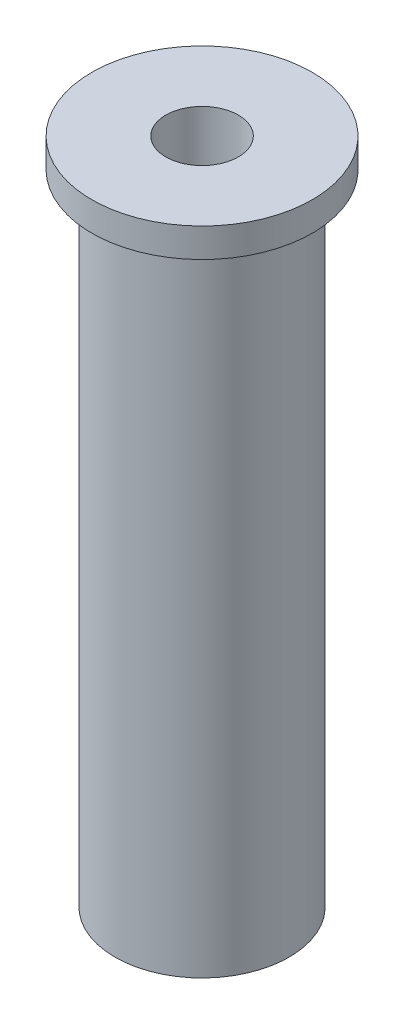
from build123d import *


with BuildPart() as part:
    # Sketch1 → Revolve1 (revolve)
    with BuildSketch(Plane(origin=(0, 0, 0), x_dir=(0, 0, -1), z_dir=(1, 0, 0))):
        Polygon((1.25, 0), (1.25, 23), (3.8, 23), (3.8, 22), (3, 22), (3, 0), align=None)
    revolve(axis=Axis((0, 0, 0), (0, 1, 0)))


solid = part.part
